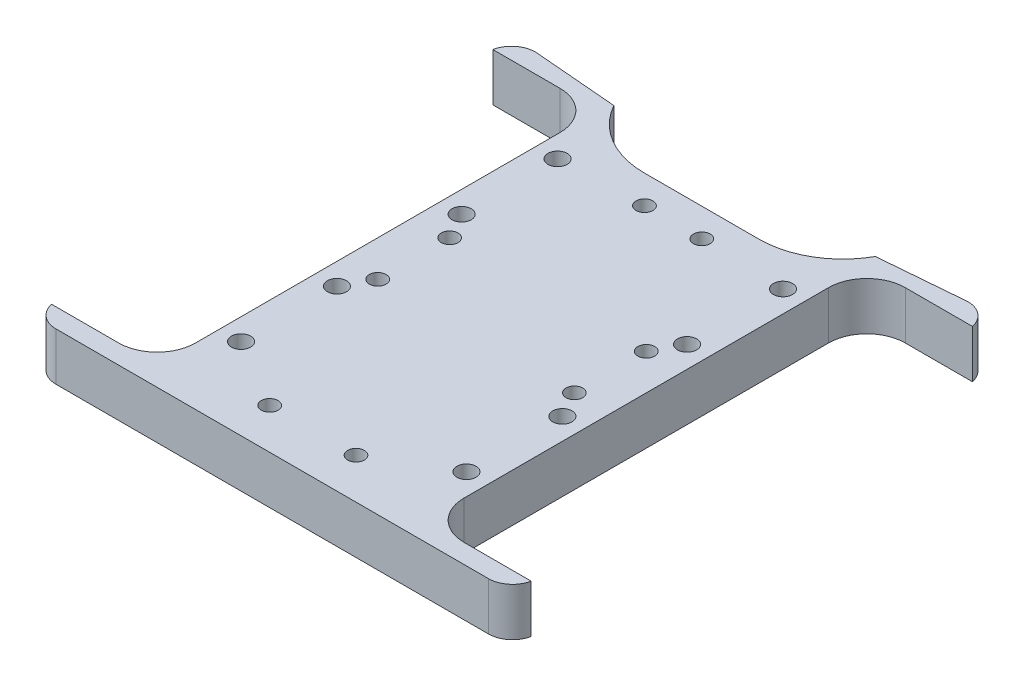
from build123d import *

# Parameters (mm, degrees)
SKETCH2_R               = 2
SKETCH2_R_2             = 1.75
BOSS_EXTRUDE1_DEPTH     = 10
FILLET1_R               = 5
CUT_EXTRUDE1_START      = -15
CUT_EXTRUDE1_DEPTH      = 15
CUT_EXTRUDE2_DEPTH      = 72.414284285
CUT_EXTRUDE2_DEPTH_BACK = 10
SKETCH5_R               = 1.75


with BuildPart() as part:
    # Sketch2 → Boss-Extrude1 (new body)
    with BuildSketch(Plane(origin=(0, 0, 0), x_dir=(1, 0, 0), z_dir=(0, 1, 0))):
        with BuildLine():
            Line((-50, 50), (-28, 50))
            ThreePointArc((-28, 50), (-21.546129824, 42.358449536), (-11.960985068, 39.5))
            Line((-11.960985068, 39.5), (11.960985068, 39.5))
            ThreePointArc((11.960985068, 39.5), (21.546129824, 42.358449536), (28, 50))
            Line((28, 50), (50, 50))
            Line((50, 50), (50, 46))
            Line((50, 46), (36, 46))
            ThreePointArc((36, 46), (30.343145751, 43.656854249), (28, 38))
            Line((28, 38), (28, -38))
            ThreePointArc((28, -38), (30.343145751, -43.656854249), (36, -46))
            Line((36, -46), (50, -46))
            Line((50, -46), (50, -50))
            Line((50, -50), (-50, -50))
            Line((-50, -50), (-50, -46))
            Line((-50, -46), (-36, -46))
            ThreePointArc((-36, -46), (-30.343145751, -43.656854249), (-28, -38))
            Line((-28, -38), (-28, 38))
            ThreePointArc((-28, 38), (-30.343145751, 43.656854249), (-36, 46))
            Line((-36, 46), (-50, 46))
            Line((-50, 46), (-50, 50))
        make_face()
        with Locations(Location((-23.5, 33, 0), (0, 0, 270))):
            Circle(SKETCH2_R, mode=Mode.SUBTRACT)
        with Locations(Location((-23.5, 13, 0), (0, 0, 270))):
            Circle(SKETCH2_R, mode=Mode.SUBTRACT)
        with Locations(Location((23.5, 33, 0), (0, 0, 270))):
            Circle(SKETCH2_R, mode=Mode.SUBTRACT)
        with Locations(Location((23.5, 13, 0), (0, 0, 270))):
            Circle(SKETCH2_R, mode=Mode.SUBTRACT)
        with Locations(Location((-23.5, -33, 0), (0, 0, 270))):
            Circle(SKETCH2_R, mode=Mode.SUBTRACT)
        with Locations(Location((23.5, -33, 0), (0, 0, 270))):
            Circle(SKETCH2_R, mode=Mode.SUBTRACT)
        with Locations(Location((23.5, -13, 0), (0, 0, 270))):
            Circle(SKETCH2_R, mode=Mode.SUBTRACT)
        with Locations(Location((-23.5, -13, 0), (0, 0, 270))):
            Circle(SKETCH2_R, mode=Mode.SUBTRACT)
        with Locations(Location((-20.5, 7.5, 0), (0, 0, 270))):
            Circle(SKETCH2_R_2, mode=Mode.SUBTRACT)
        with Locations(Location((20.5, 7.5, 0), (0, 0, 270))):
            Circle(SKETCH2_R_2, mode=Mode.SUBTRACT)
        with Locations(Location((20.5, -7.5, 0), (0, 0, 270))):
            Circle(SKETCH2_R_2, mode=Mode.SUBTRACT)
        with Locations(Location((-20.5, -7.5, 0), (0, 0, 270))):
            Circle(SKETCH2_R_2, mode=Mode.SUBTRACT)
    extrude(amount=BOSS_EXTRUDE1_DEPTH)

    # Fillet1
    # the kernel refuses this fillet: 5 mm, written as the material it takes off along each edge
    with BuildSketch(Plane(origin=(50, -12.247448714, 50), x_dir=(-1.5667467323505199e-12, 0, -1.0), z_dir=(0, 1, 0)), Plane(origin=(-50, -12.247448714, -50), x_dir=(1.5685230891899197e-12, 0, 1.0), z_dir=(0, 1, 0))) as fillet1_piece_1:
        with BuildLine():
            CenterArc((5, 4.898979486), FILLET1_R, 180, 78.463040967)
            Line((0, 4.898979486), (-0.1, 4.898979486))
            Line((-0.1, 4.898979486), (-0.1, 0))
            Line((-0.1, 0), (0, -0.1))
            ThreePointArc((0, -0.1), (2, -0.1), (3.98, -0.09797959))
            Line((3.98, -0.09797959), (4, 0))
        make_face()
    extrude(amount=34.494897428, mode=Mode.SUBTRACT)
    with BuildSketch(Plane(origin=(-50, -12.247448714, 50), x_dir=(1, 0, 0), z_dir=(0, 1, 0)), Plane(origin=(50, -12.247448714, -50), x_dir=(-1, 0, 0), z_dir=(0, 1, 0))) as fillet1_piece_2:
        with BuildLine():
            CenterArc((4.898979486, 5), FILLET1_R, 191.536959033, 78.463040967)
            Line((0, 4), (-0.09797959, 3.98))
            ThreePointArc((-0.09797959, 3.98), (-0.1, 2), (-0.1, 0))
            Line((-0.1, 0), (0, -0.1))
            Line((0, -0.1), (4.898979486, -0.1))
            Line((4.898979486, -0.1), (4.898979486, 0))
        make_face()
    extrude(amount=34.494897428, mode=Mode.SUBTRACT)

    # Sketch4 → Cut-Extrude1 (cut)
    with BuildSketch(Plane(origin=(0, 10, 0), x_dir=(1, 0, 0), z_dir=(0, 1, 0)).offset(CUT_EXTRUDE1_START)):
        with BuildLine():
            Line((45.101020514, 50), (27.258043608, 48.5))
            ThreePointArc((27.258043608, 48.5), (27.646962091, 49.24112606), (28, 50))
            Line((28, 50), (45.101020514, 50))
        make_face()
        with BuildLine():
            Line((-45.101020514, 50), (-27.258043608, 48.5))
            ThreePointArc((-27.258043608, 48.5), (-27.646962091, 49.24112606), (-28, 50))
            Line((-28, 50), (-45.101020514, 50))
        make_face()
    extrude(amount=CUT_EXTRUDE1_DEPTH, mode=Mode.SUBTRACT)

    # Sketch5 → Cut-Extrude2 (cut, two sides: drawn at the far end of the back side and taken through both)
    with BuildSketch(Plane(origin=(0, 10, 0), x_dir=(1, 0, 0), z_dir=(0, 1, 0)).offset(-CUT_EXTRUDE2_DEPTH_BACK)):
        with Locations(Location((9, -41.531499153, 0), (0, 0, 270))):
            Circle(SKETCH5_R)
        with Locations(Location((-9, -41.531499153, 0), (0, 0, 270))):
            Circle(SKETCH5_R)
        with Locations(Location((5.980492534, 33.6, 0), (0, 0, 270))):
            Circle(SKETCH5_R)
        with Locations(Location((-5.980492534, 33.6, 0), (0, 0, 270))):
            Circle(SKETCH5_R)
    extrude(amount=CUT_EXTRUDE2_DEPTH + CUT_EXTRUDE2_DEPTH_BACK, mode=Mode.SUBTRACT)


solid = part.part
